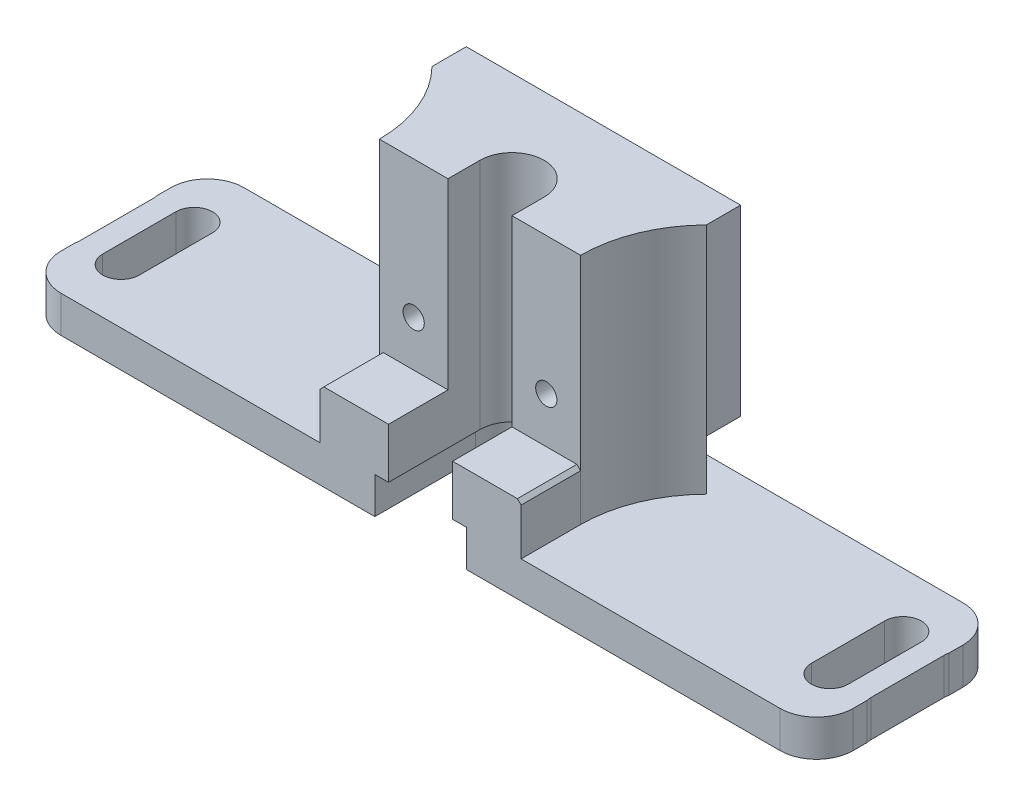
from build123d import *

# Parameters (mm, degrees)
CUT_EXTRUDE1_START     = -18.415
CUT_EXTRUDE1_OUTLINE_W = 38.1
CUT_EXTRUDE1_OUTLINE_H = 25.4
CUT_EXTRUDE1_DEPTH     = 25.0825
CUT_EXTRUDE1_2_DEPTH   = 16.0274
CUT_EXTRUDE1_3_DEPTH   = 6.6675
CUT_EXTRUDE2_DEPTH     = 2.3876
CUT_EXTRUDE3_DEPTH     = 38.867781903
CUT_EXTRUDE4_DEPTH     = 38.867781903
CUT_EXTRUDE5_DEPTH     = 38.867781903
BOSS_EXTRUDE1_START    = 6.985
BOSS_EXTRUDE1_DEPTH    = 6.985
BOSS_EXTRUDE2_DEPTH    = 5.08
SKETCH8_W              = 19.05
SKETCH8_H              = 5.08
CUT_EXTRUDE6_DEPTH     = 1.905
SKETCH9_W              = 19.05
SKETCH9_H              = 5.08
CUT_EXTRUDE7_DEPTH     = 1.905
CUT_EXTRUDE8_REACH     = 71.674
CUT_EXTRUDE9_REACH     = 71.674
CUT_EXTRUDE10_REACH    = 71.674
CUT_EXTRUDE11_REACH    = 71.674
CUT_EXTRUDE12_REACH    = 71.674
SKETCH15_W             = 1.4732
SKETCH15_H             = 16.0274
SKETCH16_W             = 1.4732
SKETCH16_H             = 16.0274
M2_5_CLEARANCE_HOLE1_D = 2.9464
FILLET1_R              = 5.08
CHAMFER2_SIZE          = 0.511100582
CHAMFER2_SIZE2         = 0.522104304
CHAMFER3_SIZE          = 0.558247665
CHAMFER3_SIZE2         = 0.538663646
SKETCH27_W             = 38.1
SKETCH27_H             = 25.4
CUT_EXTRUDE13_DEPTH    = 7.9375


with BuildPart() as part:
    # Cut-Extrude1: read off the stored shape, not the designer's step
    # Cut-Extrude1 outline → Cut-Extrude1 (new body)
    with BuildSketch(Plane.XY.offset(-2.2225).offset(CUT_EXTRUDE1_START)):
        with Locations((0, 12.7)):
            Rectangle(CUT_EXTRUDE1_OUTLINE_W, CUT_EXTRUDE1_OUTLINE_H)
        Polygon((-6.0325, 8.183087105), (-6.0325, 4.516912895), (-9.2075, 2.683825791), (-12.3825, 4.516912895), (-12.3825, 8.183087105), (-9.2075, 10.016174209), align=None, mode=Mode.SUBTRACT)
    extrude(amount=CUT_EXTRUDE1_DEPTH)

    # Cut-Extrude1 2 outline → Cut-Extrude1 2 (add)
    with BuildSketch(Plane.XY.offset(-2.2225).offset(CUT_EXTRUDE1_START)):
        Polygon((-9.2075, 2.683825791), (-6.0325, 4.516912895), (-6.0325, 8.183087105), (-9.2075, 10.016174209), (-12.3825, 8.183087105), (-12.3825, 4.516912895), align=None)
    extrude(amount=CUT_EXTRUDE1_2_DEPTH)

    # Cut-Extrude1 3 outline → Cut-Extrude1 3 (add)
    with BuildSketch(Plane.XY.offset(-2.2225)):
        Polygon((-9.2075, 2.683825791), (-6.0325, 4.516912895), (-6.0325, 8.183087105), (-9.2075, 10.016174209), (-12.3825, 8.183087105), (-12.3825, 4.516912895), align=None)
    extrude(amount=CUT_EXTRUDE1_3_DEPTH)

    # Sketch2 → Cut-Extrude2 (cut)
    with BuildSketch(Plane.XY.offset(-2.2225)):
        Polygon((6.0325, 8.183087105), (6.0325, 4.516912895), (9.2075, 2.683825791), (12.3825, 4.516912895), (12.3825, 8.183087105), (9.2075, 10.016174209), align=None)
    extrude(amount=-CUT_EXTRUDE2_DEPTH, mode=Mode.SUBTRACT)

    # Sketch3 → Cut-Extrude3 (cut, through all)
    with BuildSketch(Plane.XZ):
        with BuildLine():
            Line((-13.97, 4.445), (-19.05, 4.445))
            Line((-19.05, 4.445), (-19.05, -7.9375))
            ThreePointArc((-19.05, -7.9375), (-15.289364951, -2.247023353), (-13.97, 4.445))
        make_face()
    extrude(amount=-CUT_EXTRUDE3_DEPTH, mode=Mode.SUBTRACT)

    # Sketch4 → Cut-Extrude4 (cut, through all)
    with BuildSketch(Plane.XZ):
        with BuildLine():
            Line((4.445, 4.445), (-4.445, 4.445))
            Line((-4.445, 4.445), (-4.445, 0))
            ThreePointArc((-4.445, 0), (0, -4.445), (4.445, 0))
            Line((4.445, 0), (4.445, 4.445))
        make_face()
    extrude(amount=-CUT_EXTRUDE4_DEPTH, mode=Mode.SUBTRACT)

    # Sketch5 → Cut-Extrude5 (cut, through all)
    with BuildSketch(Plane.XZ):
        with BuildLine():
            Line((19.05, -7.9375), (19.05, 4.445))
            Line((19.05, 4.445), (13.97, 4.445))
            ThreePointArc((13.97, 4.445), (15.289364951, -2.247023353), (19.05, -7.9375))
        make_face()
    extrude(amount=-CUT_EXTRUDE5_DEPTH, mode=Mode.SUBTRACT)

    # Sketch6 → Boss-Extrude1 (add)
    with BuildSketch(Plane.XZ.offset(BOSS_EXTRUDE1_START)):
        with BuildLine():
            Line((4.445, 0), (4.445, 12.7))
            Line((4.445, 12.7), (13.97, 12.7))
            Line((13.97, 12.7), (13.97, 4.445))
            ThreePointArc((13.97, 4.445), (15.289364951, -2.247023353), (19.05, -7.9375))
            Line((19.05, -7.9375), (-19.05, -7.9375))
            ThreePointArc((-19.05, -7.9375), (-15.289364951, -2.247023353), (-13.97, 4.445))
            Line((-13.97, 4.445), (-13.97, 12.7))
            Line((-13.97, 12.7), (-4.445, 12.7))
            Line((-4.445, 12.7), (-4.445, 0))
            ThreePointArc((-4.445, 0), (0, -4.445), (4.445, 0))
        make_face()
    extrude(amount=-BOSS_EXTRUDE1_DEPTH)

    # Sketch7 → Boss-Extrude2 (add)
    with BuildSketch(Plane.XZ.offset(6.985)):
        Polygon((-4.445, -6.35), (4.445, -6.35), (4.445, 12.7), (55, 12.7), (55, -12.7), (-55, -12.7), (-55, 12.7), (-4.445, 12.7), align=None)
    extrude(amount=BOSS_EXTRUDE2_DEPTH)

    # Sketch8 → Cut-Extrude6 (cut)
    with BuildSketch(Plane.ZY.offset(-4.445)):
        with Locations((3.175, -9.525)):
            Rectangle(SKETCH8_W, SKETCH8_H)
    extrude(amount=-CUT_EXTRUDE6_DEPTH, mode=Mode.SUBTRACT)

    # Sketch9 → Cut-Extrude7 (cut)
    with BuildSketch(Plane(origin=(-4.445, 0, 0), x_dir=(0, 0, -1), z_dir=(1, 0, 0))):
        with Locations((-3.175, -9.525)):
            Rectangle(SKETCH9_W, SKETCH9_H)
    extrude(amount=-CUT_EXTRUDE7_DEPTH, mode=Mode.SUBTRACT)

    # Sketch10 → Cut-Extrude8 (cut, up to next)
    with BuildSketch(Plane.XZ.offset(12.065), mode=Mode.PRIVATE) as cut_extrude8_sk1:
        with BuildLine():
            Line((-4.490128061, -12.7), (4.490128061, -12.7))
            ThreePointArc((4.490128061, -12.7), (0, -9.525), (-4.490128061, -12.7))
        make_face()
    cut_extrude8_tool1 = extrude(cut_extrude8_sk1.sketch, amount=-CUT_EXTRUDE8_REACH, mode=Mode.PRIVATE) & part.part
    add(cut_extrude8_tool1.solids().sort_by_distance((0, -12.065, -11.384864))[0], mode=Mode.SUBTRACT)

    # Sketch11 → Cut-Extrude9 (cut, up to next)
    with BuildSketch(Plane.XZ.offset(12.065), mode=Mode.PRIVATE) as cut_extrude9_sk1:
        with BuildLine():
            Line((60.0075, -5.08), (60.0075, 5.08))
            ThreePointArc((60.0075, 5.08), (57.4675, 7.62), (54.9275, 5.08))
            Line((54.9275, 5.08), (54.9275, -5.08))
            ThreePointArc((54.9275, -5.08), (57.4675, -7.62), (60.0075, -5.08))
        make_face()
    cut_extrude9_tool1 = extrude(cut_extrude9_sk1.sketch, amount=-CUT_EXTRUDE9_REACH, mode=Mode.PRIVATE) & part.part
    add(cut_extrude9_tool1.solids().sort_by_distance((57.4675, -12.065, 0))[0], mode=Mode.SUBTRACT)

    # Sketch12 → Cut-Extrude10 (cut, up to next)
    with BuildSketch(Plane.XZ.offset(12.065), mode=Mode.PRIVATE) as cut_extrude10_sk1:
        with BuildLine():
            Line((51.7525, -5.08), (51.7525, 5.08))
            ThreePointArc((51.7525, 5.08), (49.2125, 7.62), (46.6725, 5.08))
            Line((46.6725, 5.08), (46.6725, -5.08))
            ThreePointArc((46.6725, -5.08), (49.2125, -7.62), (51.7525, -5.08))
        make_face()
    cut_extrude10_tool1 = extrude(cut_extrude10_sk1.sketch, amount=-CUT_EXTRUDE10_REACH, mode=Mode.PRIVATE) & part.part
    add(cut_extrude10_tool1.solids().sort_by_distance((49.2125, -12.065, 0))[0], mode=Mode.SUBTRACT)

    # Sketch13 → Cut-Extrude11 (cut, up to next)
    with BuildSketch(Plane.XZ.offset(12.065), mode=Mode.PRIVATE) as cut_extrude11_sk1:
        with BuildLine():
            Line((-46.6725, -5.08), (-46.6725, 5.08))
            ThreePointArc((-46.6725, 5.08), (-49.2125, 7.62), (-51.7525, 5.08))
            Line((-51.7525, 5.08), (-51.7525, -5.08))
            ThreePointArc((-51.7525, -5.08), (-49.2125, -7.62), (-46.6725, -5.08))
        make_face()
    cut_extrude11_tool1 = extrude(cut_extrude11_sk1.sketch, amount=-CUT_EXTRUDE11_REACH, mode=Mode.PRIVATE) & part.part
    add(cut_extrude11_tool1.solids().sort_by_distance((-49.2125, -12.065, 0))[0], mode=Mode.SUBTRACT)

    # Sketch14 → Cut-Extrude12 (cut, up to next)
    with BuildSketch(Plane.XZ.offset(12.065), mode=Mode.PRIVATE) as cut_extrude12_sk1:
        with BuildLine():
            Line((-54.9275, -5.08), (-54.9275, 5.08))
            ThreePointArc((-54.9275, 5.08), (-57.4675, 7.62), (-60.0075, 5.08))
            Line((-60.0075, 5.08), (-60.0075, -5.08))
            ThreePointArc((-60.0075, -5.08), (-57.4675, -7.62), (-54.9275, -5.08))
        make_face()
    cut_extrude12_tool1 = extrude(cut_extrude12_sk1.sketch, amount=-CUT_EXTRUDE12_REACH, mode=Mode.PRIVATE) & part.part
    add(cut_extrude12_tool1.solids().sort_by_distance((-57.4675, -12.065, 0))[0], mode=Mode.SUBTRACT)

    # Sketch15 → Cut-Revolve1 (revolve, cut)
    with BuildSketch(Plane(origin=(0, 6.35, 0), x_dir=(1, 0, 0), z_dir=(0, 1, 0))):
        with Locations((-8.4709, 12.6238)):
            Rectangle(SKETCH15_W, SKETCH15_H)
    revolve(axis=Axis((-9.2075, 6.35, -20.6375), (0, 0, 1)), mode=Mode.SUBTRACT)

    # Sketch16 → Cut-Revolve2 (revolve, cut)
    with BuildSketch(Plane(origin=(0, 6.35, 0), x_dir=(1, 0, 0), z_dir=(0, 1, 0))):
        with Locations((9.9441, 12.6238)):
            Rectangle(SKETCH16_W, SKETCH16_H)
    revolve(axis=Axis((9.2075, 6.35, -20.6375), (0, 0, 1)), mode=Mode.SUBTRACT)

    # M2.5 Clearance Hole1 (through all)
    with Locations(Plane.XY.offset(4.445)):
        with Locations((9.2075, 6.35), (-9.2075, 6.35)):
            Hole(M2_5_CLEARANCE_HOLE1_D / 2)

    # Fillet1
    fillet1_edges = [part.edges().sort_by_distance(p)[0] for p in [
        (-55, -9.525, 12.7),
        (-55, -9.525, -12.7),
        (55, -9.525, -12.7),
        (55, -9.525, 12.7),
        (6.35, -9.525, -6.35),
        (-6.35, -9.525, -6.35),
    ]]
    fillet(fillet1_edges, radius=FILLET1_R)

    # Chamfer2
    chamfer2_edges = [part.edges().sort_by_distance(p)[0] for p in [
        (13.97, 0, 8.5725),
    ]]
    chamfer2_side = [part.faces().sort_by_distance(p)[0] for p in [
        (13.97, -3.4925, 8.5725),
    ]]
    chamfer(chamfer2_edges, length=CHAMFER2_SIZE, length2=CHAMFER2_SIZE2, reference=chamfer2_side[0])

    # Chamfer3
    chamfer3_edges = [part.edges().sort_by_distance(p)[0] for p in [
        (-13.97, 0, 8.5725),
    ]]
    chamfer3_side = [part.faces().sort_by_distance(p)[0] for p in [
        (-13.97, -3.4925, 8.5725),
    ]]
    chamfer(chamfer3_edges, length=CHAMFER3_SIZE, length2=CHAMFER3_SIZE2, reference=chamfer3_side[0])

    # Sketch27 → Cut-Extrude13 (cut)
    with BuildSketch(Plane(origin=(0, 0, -20.6375), x_dir=(-1, 0, 0), z_dir=(0, 0, -1))):
        with Locations((0, 12.7)):
            Rectangle(SKETCH27_W, SKETCH27_H)
    extrude(amount=-CUT_EXTRUDE13_DEPTH, mode=Mode.SUBTRACT)


solid = part.part
